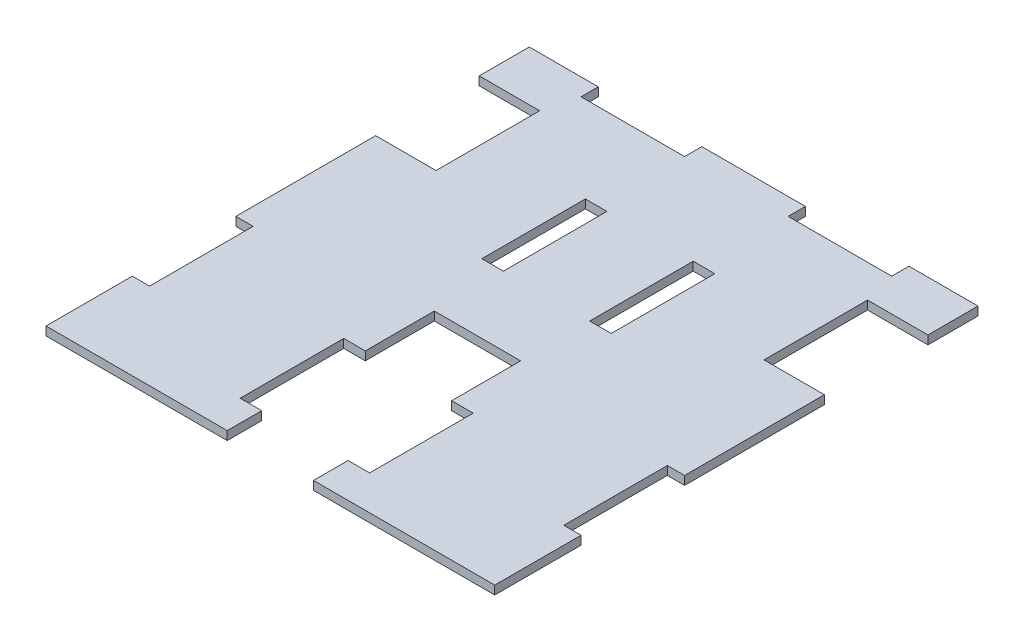
from build123d import *

# Parameters (mm, degrees)
SKETCH1_W           = 330.2
SKETCH1_H           = 355.6
BOSS_EXTRUDE1_DEPTH = 6.35
SKETCH2_W           = 63.5
SKETCH2_H           = 152.4
CUT_EXTRUDE1_DEPTH  = 243.716238641
SKETCH3_W           = 44.45
SKETCH3_H           = 76.2
CUT_EXTRUDE2_DEPTH  = 243.716238641
SKETCH4_W           = 12.7
SKETCH4_H           = 76.2
SKETCH4_W_2         = 76.2
SKETCH4_H_2         = 12.7
SKETCH4_W_3         = 15.875
CUT_EXTRUDE3_DEPTH  = 243.716238641


with BuildPart() as part:
    # Sketch1 → Boss-Extrude1 (new body)
    with BuildSketch(Plane(origin=(0, 0, 0), x_dir=(1, 0, 0), z_dir=(0, 1, 0))):
        Rectangle(SKETCH1_W, SKETCH1_H)
    extrude(amount=BOSS_EXTRUDE1_DEPTH)

    # Sketch2 → Cut-Extrude1 (cut, through all)
    with BuildSketch(Plane(origin=(0, 6.35, 0), x_dir=(1, 0, 0), z_dir=(0, 1, 0))):
        with Locations((0, -101.6)):
            Rectangle(SKETCH2_W, SKETCH2_H)
    extrude(amount=-CUT_EXTRUDE1_DEPTH, mode=Mode.SUBTRACT)

    # Sketch3 → Cut-Extrude2 (cut, through all)
    with BuildSketch(Plane(origin=(0, 6.35, 0), x_dir=(1, 0, 0), z_dir=(0, 1, 0))):
        with Locations((142.875, 102.87)):
            Rectangle(SKETCH3_W, SKETCH3_H)
        with Locations((-142.875, 102.87)):
            Rectangle(SKETCH3_W, SKETCH3_H)
    extrude(amount=-CUT_EXTRUDE2_DEPTH, mode=Mode.SUBTRACT)

    # Sketch4 → Cut-Extrude3 (cut, through all)
    with BuildSketch(Plane(origin=(0, 6.35, 0), x_dir=(1, 0, 0), z_dir=(0, 1, 0))):
        with Locations((-158.75, 102.87)):
            Rectangle(SKETCH4_W, SKETCH4_H)
        with Locations((-158.75, -76.2)):
            Rectangle(SKETCH4_W, SKETCH4_H)
        with Locations((158.75, 102.87)):
            Rectangle(SKETCH4_W, SKETCH4_H)
        with Locations((158.75, -76.2)):
            Rectangle(SKETCH4_W, SKETCH4_H)
        with Locations((76.2, 171.45)):
            Rectangle(SKETCH4_W_2, SKETCH4_H_2)
        with Locations((-76.2, 171.45)):
            Rectangle(SKETCH4_W_2, SKETCH4_H_2)
        with Locations((-39.6875, -114.3)):
            Rectangle(SKETCH4_W_3, SKETCH4_H)
        with Locations((39.6875, 63.5)):
            Rectangle(SKETCH4_W_3, SKETCH4_H)
        with Locations((-39.6875, 63.5)):
            Rectangle(SKETCH4_W_3, SKETCH4_H)
        with Locations((39.6875, -114.3)):
            Rectangle(SKETCH4_W_3, SKETCH4_H)
    extrude(amount=-CUT_EXTRUDE3_DEPTH, mode=Mode.SUBTRACT)


solid = part.part
